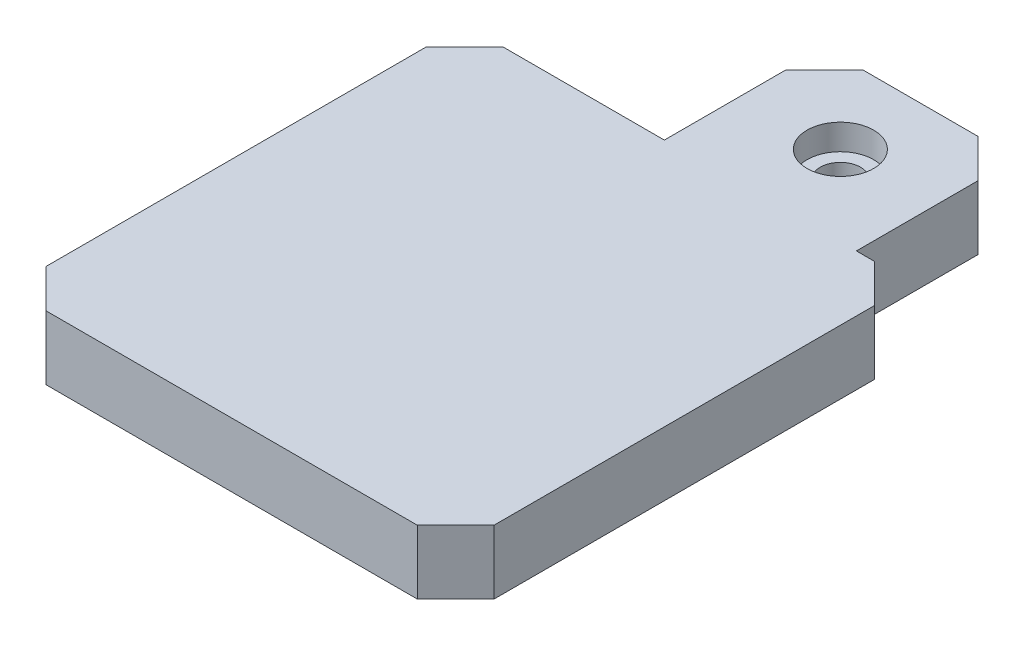
from build123d import *

# Parameters (mm, degrees)
SKETCH1_R           = 2.6
BOSS_EXTRUDE1_DEPTH = 5
CHAMFER1_SIZE       = 3
SKETCH4_R           = 2.6
SKETCH4_R_2         = 1.58
BOSS_EXTRUDE2_DEPTH = 1


with BuildPart() as part:
    # Sketch1 → Boss-Extrude1 (new body)
    with BuildSketch(Plane(origin=(0, 0, 0), x_dir=(1, 0, 0), z_dir=(0, 1, 0))):
        Polygon((-17.5, 17.5), (-17.5, -18.2), (17.5, -18.2), (17.5, 17.5), (13.1, 17.5), (13.1, 30), (-1.9, 30), (-1.9, 17.5), align=None)
        with Locations((5.6, 23.75)):
            Circle(SKETCH1_R, mode=Mode.SUBTRACT)
    extrude(amount=BOSS_EXTRUDE1_DEPTH)

    # Chamfer1
    chamfer1_edges = [part.edges().sort_by_distance(p)[0] for p in [
        (13.1, 2.5, -30),
        (-1.9, 2.5, -30),
        (17.5, 2.5, 18.2),
        (17.5, 2.5, -17.5),
        (-17.5, 2.5, 18.2),
        (-17.5, 2.5, -17.5),
    ]]
    chamfer(chamfer1_edges, length=CHAMFER1_SIZE)

    # Sketch4 → Boss-Extrude2 (add)
    with BuildSketch(Plane(origin=(0, 2, 0), x_dir=(1, 0, 0), z_dir=(0, 1, 0))):
        with Locations((5.6, 23.75)):
            Circle(SKETCH4_R)
        with Locations((5.6, 23.75)):
            Circle(SKETCH4_R_2, mode=Mode.SUBTRACT)
    extrude(amount=BOSS_EXTRUDE2_DEPTH)


solid = part.part
